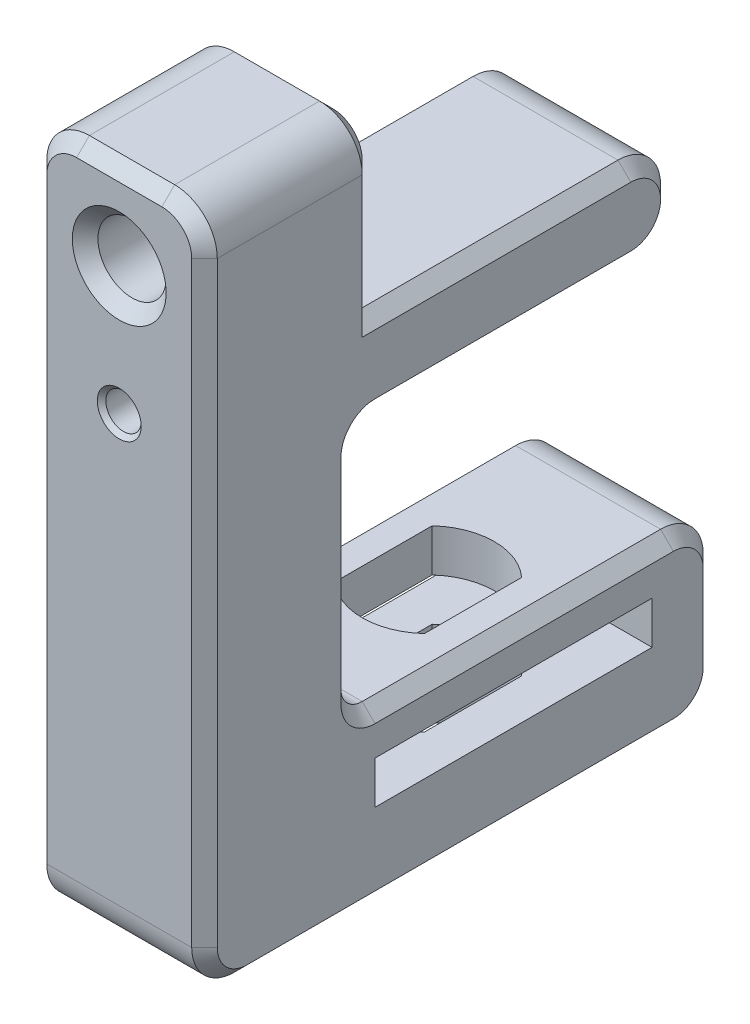
from build123d import *

# Parameters (mm, degrees)
BOSS_EXTRUDE1_DEPTH             = 40
SKETCH2_W                       = 65
SKETCH2_H                       = 10
CUT_EXTRUDE1_DEPTH              = 35
CUT_EXTRUDE2_DEPTH              = 40
SKETCH4_W                       = 55
SKETCH4_H                       = 10
CUT_EXTRUDE3_DEPTH              = 98.114622998
CHAMFER1_SIZE                   = 5
SKETCH5_W                       = 40
SKETCH5_H                       = 120
BOSS_EXTRUDE2_DEPTH             = 15
SKETCH16_W                      = 40
SKETCH16_H                      = 40
BOSS_EXTRUDE4_DEPTH             = 10
SKETCH6_R                       = 4.15
CUT_EXTRUDE4_DEPTH              = 115
CHAMFER2_SIZE                   = 1
FILLET1_R                       = 10
FILLET2_R                       = 5
SKETCH9_W                       = 40
SKETCH9_H                       = 40
BOSS_EXTRUDE3_DEPTH             = 40
FILLET3_R                       = 10
SKETCH10_R                      = 8
CUT_EXTRUDE6_DEPTH              = 20
SKETCH11_R                      = 4.5
CUT_EXTRUDE7_DEPTH              = 30
SKETCH12_R                      = 4.15
CUT_EXTRUDE8_DEPTH              = 100
CHAMFER7_SIZE                   = 1
FILLET5_R                       = 10
CHAMFER10_SIZE                  = 3
CHAMFER11_SIZE                  = 2
FILLET6_R                       = 10
CHAMFER13_SIZE                  = 3
F_1_5MM_DOWEL_HOLE1_D           = 1.5
F_1_5MM_DOWEL_HOLE1_DEPTH       = 20
F_1_5MM_DOWEL_HOLE1_CSINK_D     = 1.55
F_1_5MM_DOWEL_HOLE1_CSINK_ANGLE = 90
F_1_5MM_DOWEL_HOLE1_TIP         = 0.450645464


# Some blends are built 0.0001 mm under size
with BuildPart() as part:
    # Sketch1 → Boss-Extrude1 (new body)
    with BuildSketch(Plane(origin=(0, 0, 0), x_dir=(0, 0, -1), z_dir=(1, 0, 0))):
        Polygon((37.5, 30), (37.5, 50), (-57.5, 50), (-57.5, -70), (37.5, -70), (37.5, -30), (-37.5, -30), (-37.5, 30), align=None)
    extrude(amount=BOSS_EXTRUDE1_DEPTH)

    # Sketch2 → Cut-Extrude1 (cut)
    with BuildSketch(Plane(origin=(40, 0, 0), x_dir=(0, 0, -1), z_dir=(1, 0, 0))):
        with Locations((0, -45)):
            Rectangle(SKETCH2_W, SKETCH2_H)
    extrude(amount=-CUT_EXTRUDE1_DEPTH, mode=Mode.SUBTRACT)

    # Sketch3 → Cut-Extrude2 (cut)
    with BuildSketch(Plane.XZ.offset(70)):
        with BuildLine():
            Line((9.5, -11.401754251), (9.5, 11.401754251))
            ThreePointArc((9.5, 11.401754251), (20, 15.5), (30.5, 11.401754251))
            Line((30.5, 11.401754251), (30.5, -11.401754251))
            ThreePointArc((30.5, -11.401754251), (20, -15.5), (9.5, -11.401754251))
        make_face()
    extrude(amount=-CUT_EXTRUDE2_DEPTH, mode=Mode.SUBTRACT)

    # Sketch4 → Cut-Extrude3 (cut, through all)
    with BuildSketch(Plane(origin=(5, 0, 0), x_dir=(0, 0, -1), z_dir=(1, 0, 0))):
        with Locations((0, -45)):
            Rectangle(SKETCH4_W, SKETCH4_H)
    extrude(amount=-CUT_EXTRUDE3_DEPTH, mode=Mode.SUBTRACT)

    # Chamfer1
    chamfer1_edges = [part.edges().sort_by_distance(p)[0] for p in [
        (5, -45, 27.5),
        (5, -45, -27.5),
    ]]
    chamfer(chamfer1_edges, length=CHAMFER1_SIZE - 0.0001)  # a hair under: the kernel refuses the full size

    # Sketch5 → Boss-Extrude2 (add)
    with BuildSketch(Plane.XY.offset(57.5)):
        with Locations((20, -10)):
            Rectangle(SKETCH5_W, SKETCH5_H)
    extrude(amount=BOSS_EXTRUDE2_DEPTH)

    # Sketch16 → Boss-Extrude4 (add)
    with BuildSketch(Plane(origin=(0, 0, -37.5), x_dir=(-1, 0, 0), z_dir=(0, 0, -1))):
        with Locations((-20, -50)):
            Rectangle(SKETCH16_W, SKETCH16_H)
    extrude(amount=BOSS_EXTRUDE4_DEPTH)

    # Sketch6 → Cut-Extrude4 (cut)
    with BuildSketch(Plane.XZ.offset(70)):
        with Locations(Location((30, 57.5, 0), (0, 0, 270))):
            Circle(SKETCH6_R)
        with Locations(Location((10, 57.5, 0), (0, 0, 270))):
            Circle(SKETCH6_R)
    extrude(amount=-CUT_EXTRUDE4_DEPTH, mode=Mode.SUBTRACT)

    # Chamfer2
    chamfer2_edges = [part.edges().sort_by_distance(p)[0] for p in [
        (30, -70, 61.65),
        (10, -70, 61.65),
    ]]
    chamfer(chamfer2_edges, length=CHAMFER2_SIZE)

    # Fillet1
    # the kernel refuses this fillet: 10 mm, written as the material it takes off along each edge
    with BuildSketch(Plane(origin=(-25, -70, -47.5), x_dir=(0, 0, 1), z_dir=(1, 0, 0))) as fillet1_piece_1:
        with BuildLine():
            CenterArc((FILLET1_R, -FILLET1_R), FILLET1_R, 90, 90)
            Line((0, -FILLET1_R), (0, 0))
            Line((0, 0), (FILLET1_R, 0))
        make_face()
    extrude(amount=90, mode=Mode.SUBTRACT)
    with BuildSketch(Plane(origin=(65, -30, -47.5), x_dir=(0, -1, 0), z_dir=(-1, 0, 0)), Plane(origin=(-25, -70, 72.5), x_dir=(0, 0, -1), z_dir=(1, 0, 0))) as fillet1_piece_2:
        with BuildLine():
            CenterArc((FILLET1_R, FILLET1_R), FILLET1_R, 180, 90)
            Line((0, FILLET1_R), (0, 0))
            Line((0, 0), (FILLET1_R, 0))
        make_face()
    extrude(amount=90, mode=Mode.SUBTRACT)

    # Fillet2
    fillet2_edges = [part.edges().sort_by_distance(p)[0] for p in [
        (20, 30, 37.5),
        (20, -30, 37.5),
    ]]
    fillet(fillet2_edges, radius=FILLET2_R)

    # Sketch9 → Boss-Extrude3 (add)
    with BuildSketch(Plane(origin=(0, 50, 0), x_dir=(1, 0, 0), z_dir=(0, 1, 0))):
        with Locations((20, -52.5)):
            Rectangle(SKETCH9_W, SKETCH9_H)
    extrude(amount=BOSS_EXTRUDE3_DEPTH)

    # Fillet3
    fillet3_edges = [part.edges().sort_by_distance(p)[0] for p in [
        (0, 90, 52.5),
        (40, 90, 52.5),
    ]]
    fillet(fillet3_edges, radius=FILLET3_R)

    # Sketch10 → Cut-Extrude6 (cut)
    with BuildSketch(Plane(origin=(0, 0, 72.5), x_dir=(-1, 0, 0), z_dir=(0, 0, -1))):
        with Locations((-20, 70)):
            Circle(SKETCH10_R)
    extrude(amount=CUT_EXTRUDE6_DEPTH, mode=Mode.SUBTRACT)

    # Sketch11 → Cut-Extrude7 (cut)
    with BuildSketch(Plane.XY.offset(52.5)):
        with Locations((20, 70)):
            Circle(SKETCH11_R)
    extrude(amount=-CUT_EXTRUDE7_DEPTH, mode=Mode.SUBTRACT)

    # Sketch12 → Cut-Extrude8 (cut)
    with BuildSketch(Plane.XY.offset(72.5)):
        with Locations((20, 40)):
            Circle(SKETCH12_R)
    extrude(amount=-CUT_EXTRUDE8_DEPTH, mode=Mode.SUBTRACT)

    # Chamfer7
    chamfer7_edges = [part.edges().sort_by_distance(p)[0] for p in [
        (15.85, 40, 72.5),
    ]]
    chamfer(chamfer7_edges, length=CHAMFER7_SIZE)

    # Fillet5
    fillet5_edges = [part.edges().sort_by_distance(p)[0] for p in [
        (20, 30, -37.5),
    ]]
    fillet(fillet5_edges, radius=FILLET5_R)

    # Chamfer10
    chamfer10_edges = [part.edges().sort_by_distance(p)[0] for p in [
        (28, 70, 72.5),
    ]]
    chamfer(chamfer10_edges, length=CHAMFER10_SIZE)

    # Chamfer11
    chamfer11_edges = [part.edges().sort_by_distance(p)[0] for p in [
        (15.5, 70, 32.5),
    ]]
    chamfer(chamfer11_edges, length=CHAMFER11_SIZE)

    # Fillet6
    fillet6_edges = [part.edges().sort_by_distance(p)[0] for p in [
        (20, 50, -37.5),
    ]]
    fillet(fillet6_edges, radius=FILLET6_R - 0.0001)  # a hair under: the kernel refuses the full size

    # Chamfer13
    chamfer13_edges = [part.edges().sort_by_distance(p)[0] for p in [
        (40, -50, -47.5),
        (0, -50, -47.5),
        (0, -30, -2.5),
        (0, -70, 12.5),
        (0, -67.071067812, 69.571067812),
        (0, -32.928932188, -44.571067812),
        (0, -67.071067812, -44.571067812),
        (40, -70, 12.5),
        (40, 10, 72.5),
        (40, -30, -2.5),
        (40, -67.071067812, 69.571067812),
        (40, -32.928932188, -44.571067812),
        (40, -67.071067812, -44.571067812),
        (0, 0, 37.5),
        (40, 0, 37.5),
        (0, 30, 2.5),
        (40, 30, 2.5),
        (0, -28.535533906, 36.035533906),
        (40, -28.535533906, 36.035533906),
        (0, 28.535533906, 36.035533906),
        (40, 28.535533906, 36.035533906),
        (20, 90, 72.5),
        (20, 90, 32.5),
        (0, 10, 72.5),
        (37.071067812, 87.071067812, 72.5),
        (2.928932188, 87.071067812, 72.5),
        (0, 65, 32.5),
        (40, 65, 32.5),
        (37.071067812, 87.071067812, 32.5),
        (2.928932188, 87.071067812, 32.5),
        (0, 32.928932188, -34.571067812),
        (40, 32.928932188, -34.571067812),
        (40, 50, 2.49995),
        (0, 50, 2.49995),
        (0, 47.071097101, -34.571097101),
        (40, 47.071097101, -34.571097101),
    ]]
    chamfer(chamfer13_edges, length=CHAMFER13_SIZE)

    # Ø1.5mm Dowel Hole1
    with Locations(Plane(origin=(0, 0, 32.5), x_dir=(-1, 0, 0), z_dir=(0, 0, -1))):
        with Locations((-29.526279442, 64.5), (-20, 81), (-10.473720558, 64.5), (-20, 70)):
            CounterSinkHole(F_1_5MM_DOWEL_HOLE1_D / 2, F_1_5MM_DOWEL_HOLE1_CSINK_D / 2, depth=F_1_5MM_DOWEL_HOLE1_DEPTH, counter_sink_angle=F_1_5MM_DOWEL_HOLE1_CSINK_ANGLE)
            with Locations((0, 0, -(F_1_5MM_DOWEL_HOLE1_DEPTH + F_1_5MM_DOWEL_HOLE1_TIP / 2))):  # 118° drill point
                Cone(0, F_1_5MM_DOWEL_HOLE1_D / 2, F_1_5MM_DOWEL_HOLE1_TIP, mode=Mode.SUBTRACT)


solid = part.part
